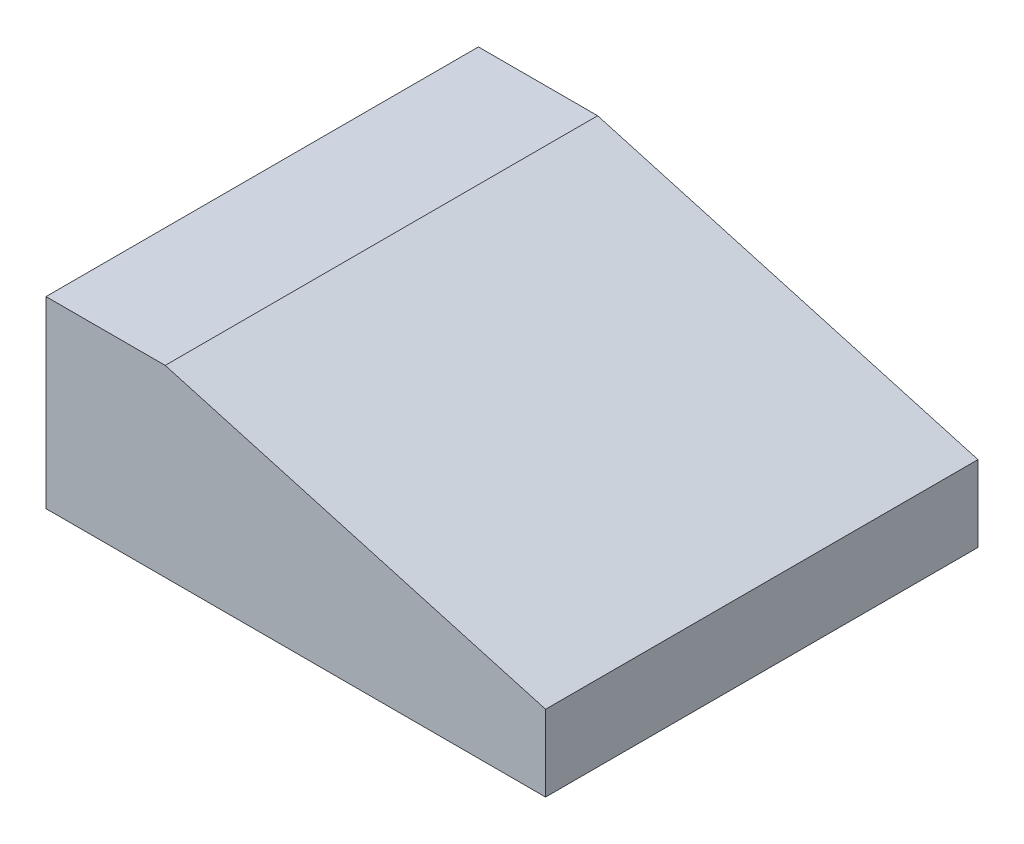
from build123d import *

# Parameters (mm, degrees)
BOSS_EXTRUDE1_DEPTH = 120


with BuildPart() as part:
    # Sketch1 → Boss-Extrude1 (new body)
    with BuildSketch(Plane.XY):
        Polygon((0, 0), (0, 50.97233393), (33.080529849, 50.97233393), (138.629302128, 21.109754456), (138.629302128, 0), align=None)
    extrude(amount=BOSS_EXTRUDE1_DEPTH)


solid = part.part
